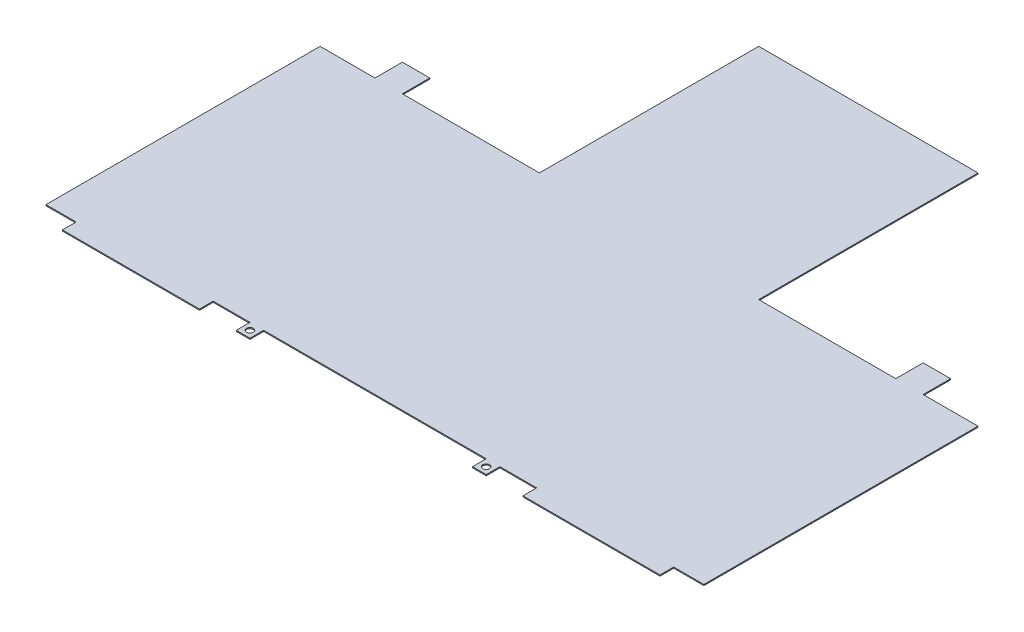
from build123d import *

# Parameters (mm, degrees)
SKETCH1_W          = 609.6
SKETCH1_H          = 254
BASE_FLANGE1_DEPTH = 1
SKETCH6_W          = 25.4
SKETCH6_H          = 25.4
TAB2_DEPTH         = 1
SKETCH11_W         = 25.4
SKETCH11_H         = 25.4
TAB3_DEPTH         = 1
SKETCH14_W         = 203.2
SKETCH14_H         = 203.2
TAB4_DEPTH         = 1
SKETCH17_W         = 127
SKETCH17_H         = 12.7
TAB5_DEPTH         = 1
SKETCH20_W         = 127
SKETCH20_H         = 12.7
TAB7_DEPTH         = 1
SKETCH25_W         = 12.7
SKETCH25_H         = 12.7
TAB8_DEPTH         = 1
SKETCH28_W         = 12.7
SKETCH28_H         = 12.7
TAB10_DEPTH        = 1
SKETCH36_R         = 3.15
CUT_EXTRUDE2_DEPTH = 450.372985392
SKETCH38_R         = 3.15
CUT_EXTRUDE3_DEPTH = 450.372985392


# Sheet-metal steps are written as plain solids
with BuildPart() as part:
    # Sketch1 → Base-Flange1 (new body)
    with BuildSketch(Plane(origin=(0, 0, 0), x_dir=(1, 0, 0), z_dir=(0, 1, 0))):
        Rectangle(SKETCH1_W, SKETCH1_H)
    extrude(amount=-BASE_FLANGE1_DEPTH)

    # Sketch6 → Tab2 (add)
    with BuildSketch(Plane(origin=(0, 0, 0), x_dir=(1, 0, 0), z_dir=(0, 1, 0))):
        with Locations((-241.3, 139.7)):
            Rectangle(SKETCH6_W, SKETCH6_H)
    extrude(amount=-TAB2_DEPTH)

    # Sketch11 → Tab3 (add)
    with BuildSketch(Plane(origin=(0, 0, 0), x_dir=(1, 0, 0), z_dir=(0, 1, 0))):
        with Locations((241.3, 139.7)):
            Rectangle(SKETCH11_W, SKETCH11_H)
    extrude(amount=-TAB3_DEPTH)

    # Sketch14 → Tab4 (add)
    with BuildSketch(Plane(origin=(0, 0, 0), x_dir=(1, 0, 0), z_dir=(0, 1, 0))):
        with Locations((0, 228.6)):
            Rectangle(SKETCH14_W, SKETCH14_H)
    extrude(amount=-TAB4_DEPTH)

    # Sketch17 → Tab5 (add)
    with BuildSketch(Plane(origin=(0, 0, 0), x_dir=(1, 0, 0), z_dir=(0, 1, 0))):
        with Locations((-213.36, -133.35)):
            Rectangle(SKETCH17_W, SKETCH17_H)
    extrude(amount=-TAB5_DEPTH)

    # Sketch20 → Tab7 (add)
    with BuildSketch(Plane(origin=(0, 0, 0), x_dir=(1, 0, 0), z_dir=(0, 1, 0))):
        with Locations((213.36, -133.35)):
            Rectangle(SKETCH20_W, SKETCH20_H)
    extrude(amount=-TAB7_DEPTH)

    # Sketch25 → Tab8 (add)
    with BuildSketch(Plane(origin=(0, 0, 0), x_dir=(1, 0, 0), z_dir=(0, 1, 0))):
        with Locations((-109.45, -133.35)):
            Rectangle(SKETCH25_W, SKETCH25_H)
    extrude(amount=-TAB8_DEPTH)

    # Sketch28 → Tab10 (add)
    with BuildSketch(Plane(origin=(0, 0, 0), x_dir=(1, 0, 0), z_dir=(0, 1, 0))):
        with Locations((109.45, -133.35)):
            Rectangle(SKETCH28_W, SKETCH28_H)
    extrude(amount=-TAB10_DEPTH)

    # Sketch36 → Cut-Extrude2 (cut, through all)
    with BuildSketch(Plane(origin=(0, 0, 0), x_dir=(1, 0, 0), z_dir=(0, 1, 0))):
        with Locations(Location((-109.45, -133.35, 0), (0, 0, 270))):
            Circle(SKETCH36_R)
    extrude(amount=-CUT_EXTRUDE2_DEPTH, mode=Mode.SUBTRACT)

    # Sketch38 → Cut-Extrude3 (cut, through all)
    with BuildSketch(Plane(origin=(0, 0, 0), x_dir=(1, 0, 0), z_dir=(0, 1, 0))):
        with Locations(Location((109.45, -133.35, 0), (0, 0, 270))):
            Circle(SKETCH38_R)
    extrude(amount=-CUT_EXTRUDE3_DEPTH, mode=Mode.SUBTRACT)


solid = part.part
